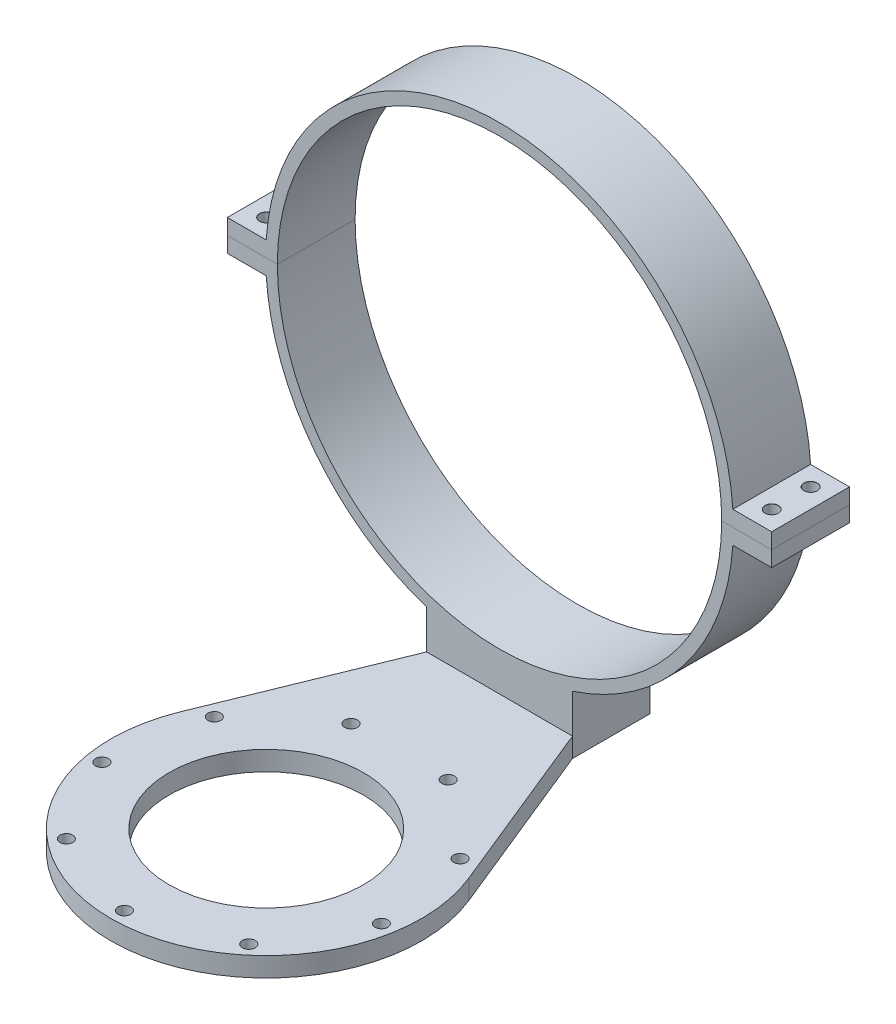
from build123d import *

# Parameters (mm, degrees)
SKETCH_1_R          = 60.15
SKETCH_1_R_2        = 57.15
EXTRUDE_1_DEPTH     = 20
SKETCH_2_W          = 10
SKETCH_2_H          = 8
EXTRUDE_2_DEPTH     = 20
SKETCH_6_W          = 37.517995682
SKETCH_6_H          = 15
EXTRUDE_3_DEPTH     = 20
EXTRUDE_4_DEPTH     = 5
CUT_EXTRUDE_1_REACH = 190.435
SKETCH_8_R          = 25
CUT_EXTRUDE_2_REACH = 190.435
SKETCH_9_R          = 1.65


# Read off the part's stored shape, not the designer's step: M3 すきま穴1
with BuildPart() as part:
    # ｽｹｯﾁ1 → ﾎﾞｽ - 押し出し1 (new body)
    with BuildSketch(Plane.XY):
        Circle(SKETCH_1_R)
        Circle(SKETCH_1_R_2, mode=Mode.SUBTRACT)
    extrude(amount=EXTRUDE_1_DEPTH)

    # ｽｹｯﾁ2 → ﾎﾞｽ - 押し出し2 (add)
    with BuildSketch(Plane.XY.offset(20)):
        with Locations((65.0168518, 0)):
            Rectangle(SKETCH_2_W, SKETCH_2_H)
        with Locations((-65.0168518, 0)):
            Rectangle(SKETCH_2_W, SKETCH_2_H)
    extrude(amount=-EXTRUDE_2_DEPTH)

    # M3 すきま穴1 outline → M3 すきま穴1 (revolve, cut)
    with BuildSketch(Plane(origin=(65.0168518, 0, 15), x_dir=(1, 0, 0), z_dir=(0, 0, 1))):
        Polygon((0, -4), (1.7, -4), (1.7, 3.97124079), (1.725, 4), (0, 4), align=None)
    revolve(axis=Axis((65.0168518, 0, 15), (0, 1, 0)), mode=Mode.SUBTRACT)

    # Hole Wizard M3 _1 2 outline → Hole Wizard M3 _1 2 (revolve, cut)
    with BuildSketch(Plane(origin=(65.0168518, 0, 5), x_dir=(1, 0, 0), z_dir=(0, 0, 1))):
        Polygon((0, -4), (1.7, -4), (1.7, 3.97124079), (1.725, 4), (0, 4), align=None)
    revolve(axis=Axis((65.0168518, 0, 5), (0, 1, 0)), mode=Mode.SUBTRACT)

    # Hole Wizard M3 _1 3 outline → Hole Wizard M3 _1 3 (revolve, cut)
    with BuildSketch(Plane(origin=(-65.0168518, 0, 15), x_dir=(1, 0, 0), z_dir=(0, 0, 1))):
        Polygon((0, -4), (1.7, -4), (1.7, 3.97124079), (1.725, 4), (0, 4), align=None)
    revolve(axis=Axis((-65.0168518, 0, 15), (0, 1, 0)), mode=Mode.SUBTRACT)

    # Hole Wizard M3 _1 4 outline → Hole Wizard M3 _1 4 (revolve, cut)
    with BuildSketch(Plane(origin=(-65.0168518, 0, 5), x_dir=(1, 0, 0), z_dir=(0, 0, 1))):
        Polygon((0, -4), (1.7, -4), (1.7, 3.97124079), (1.725, 4), (0, 4), align=None)
    revolve(axis=Axis((-65.0168518, 0, 5), (0, 1, 0)), mode=Mode.SUBTRACT)

    # ｽｹｯﾁ6 → ﾎﾞｽ - 押し出し3 (add)
    with BuildSketch(Plane.XY.offset(20)):
        with Locations((0, -64.65)):
            Rectangle(SKETCH_6_W, SKETCH_6_H)
    extrude(amount=-EXTRUDE_3_DEPTH)

    # ｽｹｯﾁ7 → ﾎﾞｽ - 押し出し4 (add)
    with BuildSketch(Plane.XZ.offset(72.15)):
        with BuildLine():
            Line((-18.758997841, 20), (-37.046923361, 64.916052589))
            ThreePointArc((-37.046923361, 64.916052589), (0, 120), (37.046923361, 64.916052589))
            Line((37.046923361, 64.916052589), (18.758997841, 20))
            Line((18.758997841, 20), (-18.758997841, 20))
        make_face()
    extrude(amount=-EXTRUDE_4_DEPTH)

    # ｽｹｯﾁ8 → ｶｯﾄ - 押し出し1 (cut, up to next)
    with BuildSketch(Plane(origin=(0, -67.15, 0), x_dir=(1, 0, 0), z_dir=(0, 1, 0)), mode=Mode.PRIVATE) as cut_extrude_1_sk1:
        with Locations(Location((0, -80, 0), (0, 0, 270))):
            Circle(SKETCH_8_R)
    cut_extrude_1_tool1 = extrude(cut_extrude_1_sk1.sketch, amount=-CUT_EXTRUDE_1_REACH, mode=Mode.PRIVATE) & part.part
    add(cut_extrude_1_tool1.solids().sort_by_distance((0, -67.15, 80))[0], mode=Mode.SUBTRACT)

    # ｽｹｯﾁ9 → ｶｯﾄ - 押し出し2 (cut, up to next)
    with BuildSketch(Plane(origin=(0, -67.15, 0), x_dir=(1, 0, 0), z_dir=(0, 1, 0)), mode=Mode.PRIVATE) as cut_extrude_2_sk1:
        with Locations(Location((0, -116.5, 0), (0, 0, 270))):
            Circle(SKETCH_9_R)
    cut_extrude_2_tool1 = extrude(cut_extrude_2_sk1.sketch, amount=-CUT_EXTRUDE_2_REACH, mode=Mode.PRIVATE) & part.part
    # ｽｹｯﾁ9 → ｶｯﾄ - 押し出し2 (cut, up to next)
    with BuildSketch(Plane(origin=(0, -67.15, 0), x_dir=(1, 0, 0), z_dir=(0, 1, 0)), mode=Mode.PRIVATE) as cut_extrude_2_sk2:
        with Locations(Location((-23.461747754, -107.960622174, 0), (0, 0, 270))):
            Circle(SKETCH_9_R)
    cut_extrude_2_tool2 = extrude(cut_extrude_2_sk2.sketch, amount=-CUT_EXTRUDE_2_REACH, mode=Mode.PRIVATE) & part.part
    # ｽｹｯﾁ9 → ｶｯﾄ - 押し出し2 (cut, up to next)
    with BuildSketch(Plane(origin=(0, -67.15, 0), x_dir=(1, 0, 0), z_dir=(0, 1, 0)), mode=Mode.PRIVATE) as cut_extrude_2_sk3:
        with Locations(Location((-35.945482985, -86.338158485, 0), (0, 0, 270))):
            Circle(SKETCH_9_R)
    cut_extrude_2_tool3 = extrude(cut_extrude_2_sk3.sketch, amount=-CUT_EXTRUDE_2_REACH, mode=Mode.PRIVATE) & part.part
    # ｽｹｯﾁ9 → ｶｯﾄ - 押し出し2 (cut, up to next)
    with BuildSketch(Plane(origin=(0, -67.15, 0), x_dir=(1, 0, 0), z_dir=(0, 1, 0)), mode=Mode.PRIVATE) as cut_extrude_2_sk4:
        with Locations(Location((-31.609927238, -61.75, 0), (0, 0, 270))):
            Circle(SKETCH_9_R)
    cut_extrude_2_tool4 = extrude(cut_extrude_2_sk4.sketch, amount=-CUT_EXTRUDE_2_REACH, mode=Mode.PRIVATE) & part.part
    # ｽｹｯﾁ9 → ｶｯﾄ - 押し出し2 (cut, up to next)
    with BuildSketch(Plane(origin=(0, -67.15, 0), x_dir=(1, 0, 0), z_dir=(0, 1, 0)), mode=Mode.PRIVATE) as cut_extrude_2_sk5:
        with Locations(Location((-12.483735231, -45.701219341, 0), (0, 0, 270))):
            Circle(SKETCH_9_R)
    cut_extrude_2_tool5 = extrude(cut_extrude_2_sk5.sketch, amount=-CUT_EXTRUDE_2_REACH, mode=Mode.PRIVATE) & part.part
    # ｽｹｯﾁ9 → ｶｯﾄ - 押し出し2 (cut, up to next)
    with BuildSketch(Plane(origin=(0, -67.15, 0), x_dir=(1, 0, 0), z_dir=(0, 1, 0)), mode=Mode.PRIVATE) as cut_extrude_2_sk6:
        with Locations(Location((12.483735231, -45.701219341, 0), (0, 0, 270))):
            Circle(SKETCH_9_R)
    cut_extrude_2_tool6 = extrude(cut_extrude_2_sk6.sketch, amount=-CUT_EXTRUDE_2_REACH, mode=Mode.PRIVATE) & part.part
    # ｽｹｯﾁ9 → ｶｯﾄ - 押し出し2 (cut, up to next)
    with BuildSketch(Plane(origin=(0, -67.15, 0), x_dir=(1, 0, 0), z_dir=(0, 1, 0)), mode=Mode.PRIVATE) as cut_extrude_2_sk7:
        with Locations(Location((31.609927238, -61.75, 0), (0, 0, 270))):
            Circle(SKETCH_9_R)
    cut_extrude_2_tool7 = extrude(cut_extrude_2_sk7.sketch, amount=-CUT_EXTRUDE_2_REACH, mode=Mode.PRIVATE) & part.part
    # ｽｹｯﾁ9 → ｶｯﾄ - 押し出し2 (cut, up to next)
    with BuildSketch(Plane(origin=(0, -67.15, 0), x_dir=(1, 0, 0), z_dir=(0, 1, 0)), mode=Mode.PRIVATE) as cut_extrude_2_sk8:
        with Locations(Location((35.945482985, -86.338158485, 0), (0, 0, 270))):
            Circle(SKETCH_9_R)
    cut_extrude_2_tool8 = extrude(cut_extrude_2_sk8.sketch, amount=-CUT_EXTRUDE_2_REACH, mode=Mode.PRIVATE) & part.part
    # ｽｹｯﾁ9 → ｶｯﾄ - 押し出し2 (cut, up to next)
    with BuildSketch(Plane(origin=(0, -67.15, 0), x_dir=(1, 0, 0), z_dir=(0, 1, 0)), mode=Mode.PRIVATE) as cut_extrude_2_sk9:
        with Locations(Location((23.461747754, -107.960622174, 0), (0, 0, 270))):
            Circle(SKETCH_9_R)
    cut_extrude_2_tool9 = extrude(cut_extrude_2_sk9.sketch, amount=-CUT_EXTRUDE_2_REACH, mode=Mode.PRIVATE) & part.part
    add(cut_extrude_2_tool1.solids().sort_by_distance((0, -67.15, 116.5))[0], mode=Mode.SUBTRACT)
    add(cut_extrude_2_tool2.solids().sort_by_distance((-23.461748, -67.15, 107.960622))[0], mode=Mode.SUBTRACT)
    add(cut_extrude_2_tool3.solids().sort_by_distance((-35.945483, -67.15, 86.338158))[0], mode=Mode.SUBTRACT)
    add(cut_extrude_2_tool4.solids().sort_by_distance((-31.609927, -67.15, 61.75))[0], mode=Mode.SUBTRACT)
    add(cut_extrude_2_tool5.solids().sort_by_distance((-12.483735, -67.15, 45.701219))[0], mode=Mode.SUBTRACT)
    add(cut_extrude_2_tool6.solids().sort_by_distance((12.483735, -67.15, 45.701219))[0], mode=Mode.SUBTRACT)
    add(cut_extrude_2_tool7.solids().sort_by_distance((31.609927, -67.15, 61.75))[0], mode=Mode.SUBTRACT)
    add(cut_extrude_2_tool8.solids().sort_by_distance((35.945483, -67.15, 86.338158))[0], mode=Mode.SUBTRACT)
    add(cut_extrude_2_tool9.solids().sort_by_distance((23.461748, -67.15, 107.960622))[0], mode=Mode.SUBTRACT)


with BuildPart() as body_2:
    # Split Bodies 1: the piece on the far side of the plane
    add(part.part)
    split(bisect_by=Plane.ZX, keep=Keep.BOTTOM)


with BuildPart() as part_1:
    add(part.part)

    # Split Bodies 1
    split(bisect_by=Plane.ZX, keep=Keep.TOP)


solid = Compound([body_2.part, part_1.part])
